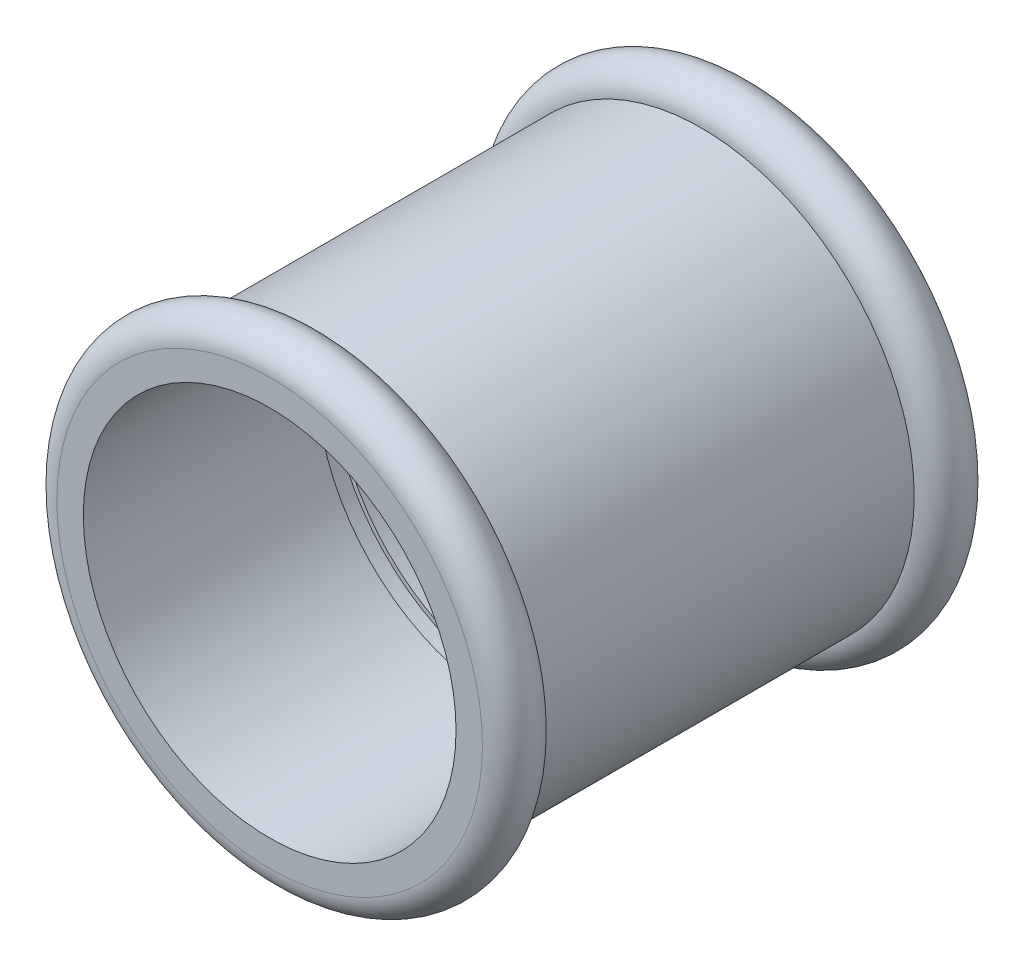
from build123d import *

# Parameters (mm, degrees)
SKETCH1_R                = 24.15
SKETCH1_R_2              = 21.15
EXTRUDE1_DEPTH           = 55
CUT_EXTRUDE_1_DEPTH      = 1
CUT_EXTRUDE_1_DEPTH_BACK = 1
SKETCH_1_R               = 21.65
SKETCH_1_R_2             = 20.65


# Read off the part's stored shape, not the designer's step: Revolve-Thin2
with BuildPart() as part:
    # Sketch1 → Extrude1 (new body)
    with BuildSketch(Plane.XY):
        Circle(SKETCH1_R)
        Circle(SKETCH1_R_2, mode=Mode.SUBTRACT)
    extrude(amount=EXTRUDE1_DEPTH)

    # Эскиз1 → Вырез-Вытянуть-Тонкостенный1 (cut, two sides: drawn at the far end of the back side and taken through both)
    with BuildSketch(Plane(origin=(0, 0, 27.5), x_dir=(-1, 0, 0), z_dir=(0, 0, -1)).offset(-CUT_EXTRUDE_1_DEPTH_BACK)):
        Circle(SKETCH_1_R)
        Circle(SKETCH_1_R_2, mode=Mode.SUBTRACT)
    extrude(amount=CUT_EXTRUDE_1_DEPTH + CUT_EXTRUDE_1_DEPTH_BACK, mode=Mode.SUBTRACT)


with BuildPart() as body_2:
    # Revolve-Thin2 outline → Revolve-Thin2 (revolve)
    # profile 1 of 2: a face of its own
    with BuildSketch(Plane.XZ):
        with BuildLine():
            Line((24.15, 6), (24.15, 0))
            ThreePointArc((24.15, 0), (27.15, 3), (24.15, 6))
        make_face()
        with BuildLine():
            Line((25.15, 1.267949192), (25.15, 4.732050808))
            ThreePointArc((25.15, 4.732050808), (26.15, 3), (25.15, 1.267949192))
        make_face(mode=Mode.SUBTRACT)
    # profile 2 of 2: a face of its own
    with BuildSketch(Plane.XZ):
        with BuildLine():
            Line((24.15, 55), (24.15, 49))
            ThreePointArc((24.15, 49), (27.15, 52), (24.15, 55))
        make_face()
        with BuildLine():
            Line((25.15, 50.267949192), (25.15, 53.732050808))
            ThreePointArc((25.15, 53.732050808), (26.15, 52), (25.15, 50.267949192))
        make_face(mode=Mode.SUBTRACT)
    revolve(axis=Axis((0, 0, 0), (0, 0, 1)))


solid = Compound([part.part, body_2.part])
